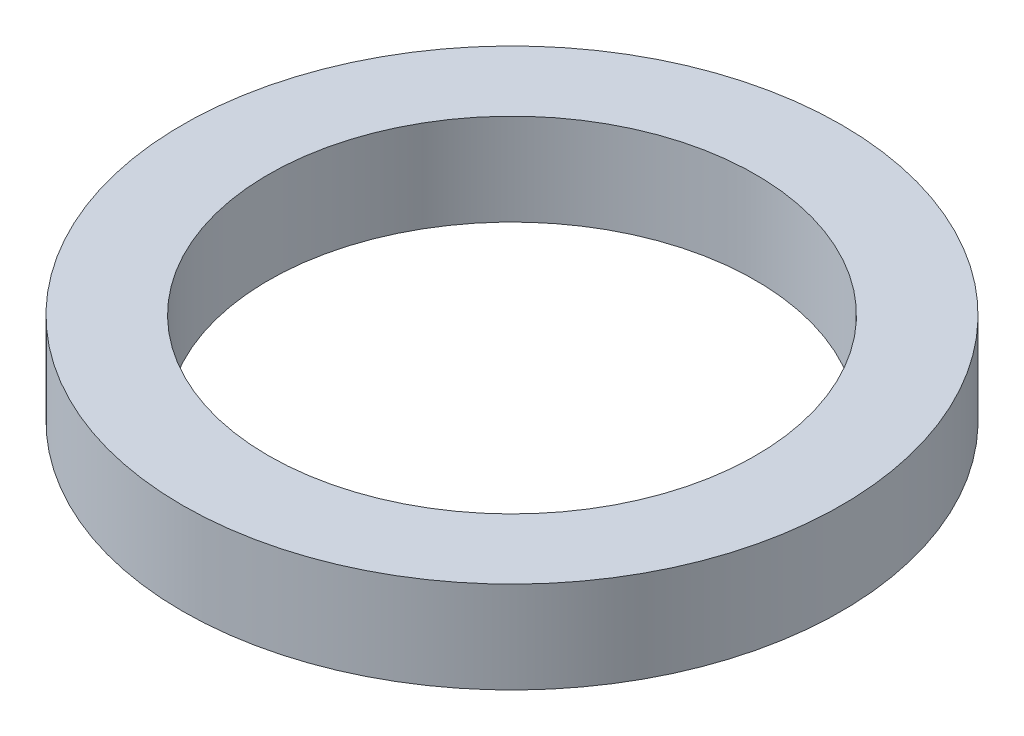
from build123d import *

# Parameters (mm, degrees)
SKETCH1_R           = 57.5
BOSS_EXTRUDE1_DEPTH = 16
SKETCH2_R           = 42.5
CUT_EXTRUDE1_DEPTH  = 83.876414015


with BuildPart() as part:
    # Sketch1 → Boss-Extrude1 (new body)
    with BuildSketch(Plane(origin=(0, 0, 0), x_dir=(1, 0, 0), z_dir=(0, 1, 0))):
        Circle(SKETCH1_R)
    extrude(amount=BOSS_EXTRUDE1_DEPTH)

    # Sketch2 → Cut-Extrude1 (cut, through all)
    with BuildSketch(Plane(origin=(0, 0, 0), x_dir=(1, 0, 0), z_dir=(0, 1, 0))):
        Circle(SKETCH2_R)
    extrude(amount=CUT_EXTRUDE1_DEPTH, mode=Mode.SUBTRACT)


solid = part.part
